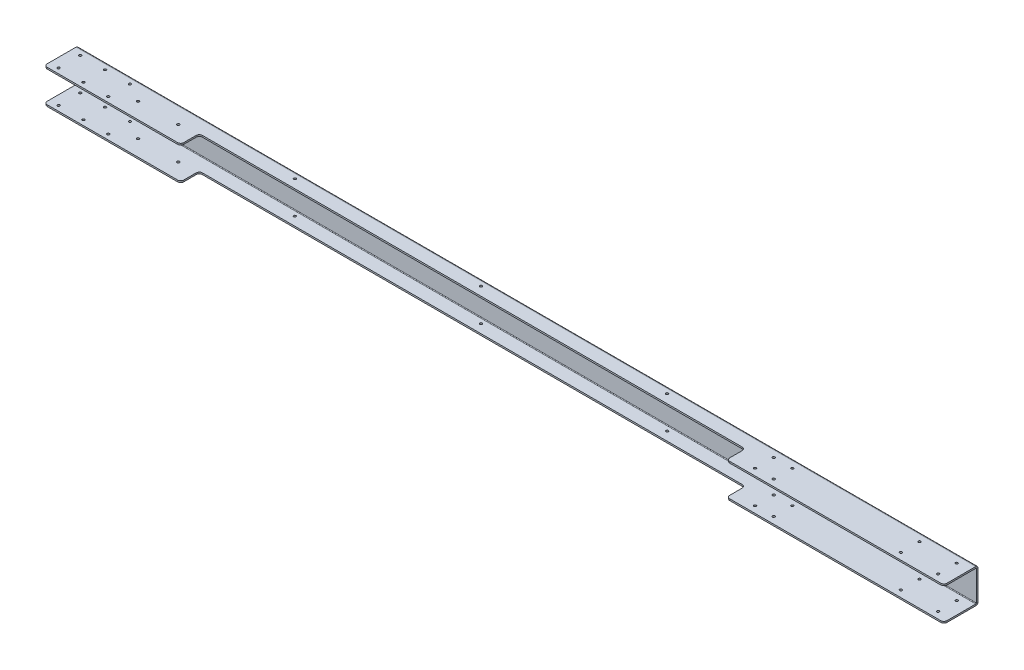
from build123d import *

# Parameters (mm, degrees)
SKETCH2_W                      = 1841.5
SKETCH2_H                      = 69.6722
BASE_FLANGE1_DEPTH             = 3.2639
EDGE_FLANGE1_STRIP_W           = 15.5956
EDGE_FLANGE1_STRIP_H           = 3.2639
EDGE_FLANGE1_STRIP_CUT_DEPTH   = 1841.5
EDGE_FLANGE1_STRIP_2_W         = 15.5956
EDGE_FLANGE1_STRIP_2_H         = 3.2639
EDGE_FLANGE1_STRIP_CUT_2_DEPTH = 1841.5
EDGE_FLANGE1_DEPTH             = 1841.5
EDGE_FLANGE1_BEND_DEPTH        = 1841.5
F_10_0_1935_DIAMETER_HOLE1_D   = 4.9149
F_10_0_1935_DIAMETER_HOLE3_D   = 4.9149
F_10_0_1935_DIAMETER_HOLE4_D   = 4.9149
F_10_0_2_DIAMETER_HOLE1_D      = 5.08
F_10_0_1935_DIAMETER_HOLE6_D   = 4.9149
LPATTERN2_COUNT                = 3
LPATTERN2_PITCH                = 381
CUT_EXTRUDE1_DEPTH             = 926.779934253
FILLET2_R                      = 6.35


# Sheet-metal steps are written as plain solids
with BuildPart() as part:
    # Sketch2 → Base-Flange1 (new body)
    with BuildSketch(Plane.XY):
        Rectangle(SKETCH2_W, SKETCH2_H)
    extrude(amount=-BASE_FLANGE1_DEPTH)

    # Edge-Flange1 strip (across the edge) → Edge-Flange1 strip cut (cut)
    with BuildSketch(Plane(origin=(920.75, 34.8361, 0), x_dir=(0, -1, 0), z_dir=(-1, 0, 0))):
        with Locations((-3.2639, -1.63195)):
            Rectangle(EDGE_FLANGE1_STRIP_W, EDGE_FLANGE1_STRIP_H)
    extrude(amount=EDGE_FLANGE1_STRIP_CUT_DEPTH, mode=Mode.SUBTRACT)

    # Edge-Flange1 strip 2 (across the edge) → Edge-Flange1 strip cut 2 (cut)
    with BuildSketch(Plane(origin=(-920.75, -34.8361, 0), x_dir=(0, 1, 0), z_dir=(1, 0, 0))):
        with Locations((-3.2639, -1.63195)):
            Rectangle(EDGE_FLANGE1_STRIP_2_W, EDGE_FLANGE1_STRIP_2_H)
    extrude(amount=EDGE_FLANGE1_STRIP_CUT_2_DEPTH, mode=Mode.SUBTRACT)

    # Edge-Flange1 section (across the edge) → Edge-Flange1 (add)
    with BuildSketch(Plane(origin=(920.75, 34.8361, 0), x_dir=(0, -1, 0), z_dir=(-1, 0, 0))):
        with BuildLine():
            Line((0, 1.27), (0, 66.5861))
            Line((0, 66.5861), (3.2639, 66.5861))
            Line((3.2639, 66.5861), (3.2639, 1.27))
            ThreePointArc((3.2639, 1.27), (3.635874388, 0.371974388), (4.5339, 0))
            Line((4.5339, 0), (4.5339, -3.2639))
            ThreePointArc((4.5339, -3.2639), (1.327948565, -1.935951435), (0, 1.27))
        make_face()
    extrude(amount=EDGE_FLANGE1_DEPTH)

    # Edge-Flange1 section 2 (across the edge) → Edge-Flange1 bend (add)
    with BuildSketch(Plane(origin=(-920.75, -34.8361, 0), x_dir=(0, 1, 0), z_dir=(1, 0, 0))):
        with BuildLine():
            Line((0, 1.27), (0, 66.5861))
            Line((0, 66.5861), (3.2639, 66.5861))
            Line((3.2639, 66.5861), (3.2639, 1.27))
            ThreePointArc((3.2639, 1.27), (3.635874388, 0.371974388), (4.5339, 0))
            Line((4.5339, 0), (4.5339, -3.2639))
            ThreePointArc((4.5339, -3.2639), (1.327948565, -1.935951435), (0, 1.27))
        make_face()
    extrude(amount=EDGE_FLANGE1_BEND_DEPTH)

    # #10 (0.1935) Diameter Hole1 (through all)
    with Locations(Plane(origin=(0, 34.8361, 34.8361), x_dir=(-1, 0, 0), z_dir=(0, 1, 0))):
        with Locations((800.1, -23.13305), (800.1, 21.31695), (850.9, 21.31695), (850.9, -23.13305), (901.7, 21.31695), (901.7, -23.13305)):
            Hole(F_10_0_1935_DIAMETER_HOLE1_D / 2)

    # #10 (0.1935) Diameter Hole3 (through all)
    with Locations(Plane(origin=(0, 34.8361, 0), x_dir=(1, 0, 0), z_dir=(0, 1, 0))):
        with Locations((819.15, -14.87805), (819.15, -52.97805), (895.35, -14.87805), (895.35, -52.97805)):
            Hole(F_10_0_1935_DIAMETER_HOLE3_D / 2)

    # #10 (0.1935) Diameter Hole4 (through all)
    with Locations(Plane(origin=(0, 34.8361, 0), x_dir=(1, 0, 0), z_dir=(0, 1, 0))):
        with Locations((520.7, -14.87805), (558.8, -14.87805), (558.8, -52.97805), (520.7, -52.97805)):
            Hole(F_10_0_1935_DIAMETER_HOLE4_D / 2)

    # #10 (0.2) Diameter Hole1 (through all)
    with Locations(Plane(origin=(0, 34.8361, 0), x_dir=(1, 0, 0), z_dir=(0, 1, 0))):
        with Locations((-761.32055, -33.92805), (-678.77055, -33.92805)):
            Hole(F_10_0_2_DIAMETER_HOLE1_D / 2)

    # #10 (0.1935) Diameter Hole6 (through all)
    with Locations(Plane(origin=(0, -34.8361, 0), x_dir=(-1, 0, 0), z_dir=(0, -1, 0))):
        with Locations((463.55, -10.795)):
            f_10_0_1935_diameter_hole6 = Hole(F_10_0_1935_DIAMETER_HOLE6_D / 2)

    # LPattern2: #10 (0.1935) Diameter Hole6 ×3
    with Locations(*[(i * LPATTERN2_PITCH, 0, 0) for i in range(1, LPATTERN2_COUNT)]):
        add(f_10_0_1935_diameter_hole6, mode=Mode.SUBTRACT)

    # Sketch46 → Cut-Extrude1 (cut, through all)
    with BuildSketch(Plane(origin=(0, 34.8361, 0), x_dir=(1, 0, 0), z_dir=(0, 1, 0))):
        Polygon((-641.35, -28.4861), (-641.35, -66.5861), (476.25, -66.5861), (476.25, -28.4861), (-82.55, -28.4861), align=None)
    extrude(amount=-CUT_EXTRUDE1_DEPTH, mode=Mode.SUBTRACT)

    # Fillet2
    fillet2_edges = [part.edges().sort_by_distance(p)[0] for p in [
        (476.25, 33.20415, 66.5861),
        (-641.35, 33.20415, 28.4861),
        (-641.35, 33.20415, 66.5861),
        (476.25, 33.20415, 28.4861),
        (476.25, -33.20415, 66.5861),
        (-641.35, -33.20415, 66.5861),
        (-641.35, -33.20415, 28.4861),
        (476.25, -33.20415, 28.4861),
        (920.75, 33.20415, 66.5861),
        (-920.75, 33.20415, 66.5861),
        (-920.75, -33.20415, 66.5861),
        (920.75, -33.20415, 66.5861),
    ]]
    fillet(fillet2_edges, radius=FILLET2_R)


solid = part.part
